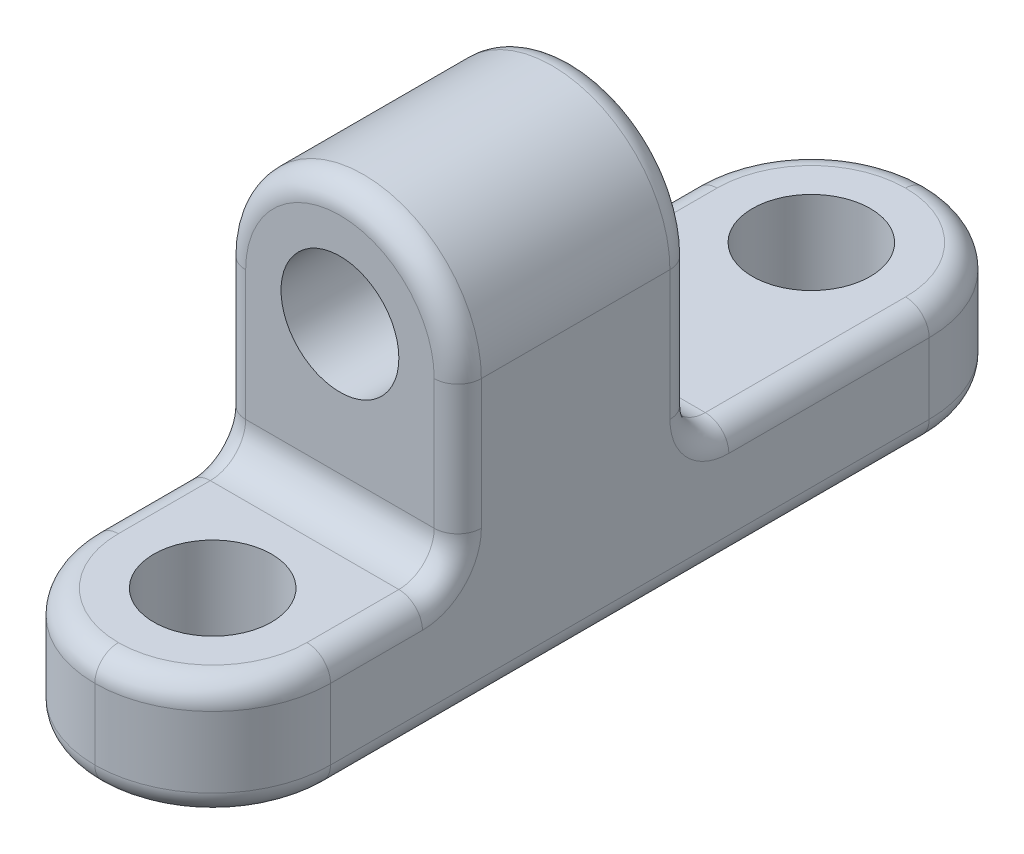
from build123d import *

# Parameters (mm, degrees)
SKETCH1_R           = 2.5
BOSS_EXTRUDE1_DEPTH = 10
SKETCH2_W           = 10
SKETCH2_H           = 15
SKETCH2_R           = 2.5
SKETCH2_H_2         = 10.4
BOSS_EXTRUDE2_DEPTH = 5
FILLET1_R           = 5
FILLET2_R           = 1.5
FILLET3_R           = 1


with BuildPart() as part:
    # Sketch1 → Boss-Extrude1 (new body)
    with BuildSketch(Plane.XY):
        with BuildLine():
            Line((-5, 0), (-5, -12))
            Line((-5, -12), (5, -12))
            Line((5, -12), (5, 0))
            ThreePointArc((5, 0), (0, 5), (-5, 0))
        make_face()
        Circle(SKETCH1_R, mode=Mode.SUBTRACT)
    extrude(amount=BOSS_EXTRUDE1_DEPTH)

    # Sketch2 → Boss-Extrude2 (add)
    # profile 1 of 2: a face of its own
    with BuildSketch(Plane.XZ.offset(12)):
        with Locations((0, -7.5)):
            Rectangle(SKETCH2_W, SKETCH2_H)
        with Locations(Location((0, -10, 0), (0, 0, 270))):
            Circle(SKETCH2_R, mode=Mode.SUBTRACT)
    # profile 2 of 2: a face of its own
    with BuildSketch(Plane.XZ.offset(12)):
        with Locations((0, 15.2)):
            Rectangle(SKETCH2_W, SKETCH2_H_2)
        with Locations(Location((0, 15.4, 0), (0, 0, 270))):
            Circle(SKETCH2_R, mode=Mode.SUBTRACT)
    extrude(amount=-BOSS_EXTRUDE2_DEPTH)

    # Fillet1
    fillet1_edges = [part.edges().sort_by_distance(p)[0] for p in [
        (5, -9.5, -15),
        (5, -9.5, 20.4),
        (-5, -9.5, 20.4),
        (-5, -9.5, -15),
    ]]
    fillet(fillet1_edges, radius=FILLET1_R - 0.0001)  # a hair under: the kernel refuses the full size

    # Fillet2
    fillet2_edges = [part.edges().sort_by_distance(p)[0] for p in [
        (0, -7, 0),
        (0, -7, 10),
    ]]
    fillet(fillet2_edges, radius=FILLET2_R)

    # Fillet3
    fillet3_edges = [part.edges().sort_by_distance(p)[0] for p in [
        (5, -2.75, 10),
        (0, 5, 10),
        (-5, -2.75, 10),
        (-5, -12, 2.7),
        (5, -12, 2.7),
        (-3.535563195, -12, -13.535563195),
        (3.535563195, -12, -13.535563195),
        (-3.535563195, -12, 18.935563195),
        (3.535563195, -12, 18.935563195),
        (5, -7, -5.75005),
        (-3.535563195, -7, -13.535563195),
        (3.535563195, -7, -13.535563195),
        (-5, -7, 13.45005),
        (-3.535563195, -7, 18.935563195),
        (3.535563195, -7, 18.935563195),
        (5, -7, 13.45005),
        (-5, -7, -5.75005),
        (5, -6.560660172, 10.439339828),
        (-5, -6.560660172, 10.439339828),
        (-5, -6.560660172, -0.439339828),
        (5, -6.560660172, -0.439339828),
        (-5, -2.75, 0),
        (0, 5, 0),
        (5, -2.75, 0),
    ]]
    fillet(fillet3_edges, radius=FILLET3_R)


solid = part.part
